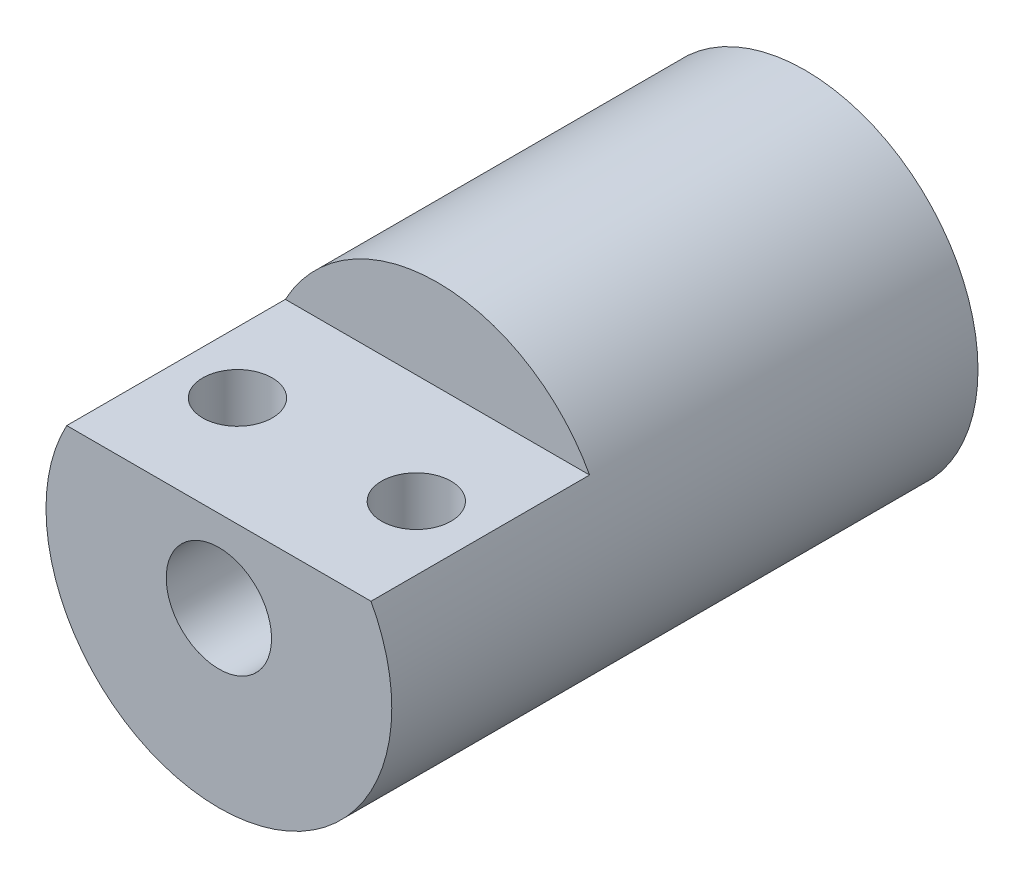
from build123d import *

# Parameters (mm, degrees)
SKETCH1_R           = 8.7
BOSS_EXTRUDE1_DEPTH = 29.5
SKETCH5_R           = 1.75
CUT_EXTRUDE1_DEPTH  = 32.962947298
SKETCH4_R           = 1.25
CUT_EXTRUDE2_DEPTH  = 7
SKETCH6_R           = 2.65
CUT_EXTRUDE3_DEPTH  = 20.9
SKETCH2_W           = 17
SKETCH2_H           = 4.566888769
CUT_EXTRUDE4_DEPTH  = 11
FILLET1_R           = 0.3
SKETCH7_R           = 1.75
CUT_EXTRUDE5_DEPTH  = 34.326097039


with BuildPart() as part:
    # Sketch1 → Boss-Extrude1 (new body)
    with BuildSketch(Plane.XY):
        Circle(SKETCH1_R)
    extrude(amount=BOSS_EXTRUDE1_DEPTH)

    # Sketch5 → Cut-Extrude1 (cut, through all)
    with BuildSketch(Plane(origin=(0, 0, 0), x_dir=(-1, 0, 0), z_dir=(0, 0, -1))):
        Circle(SKETCH5_R)
    extrude(amount=-CUT_EXTRUDE1_DEPTH, mode=Mode.SUBTRACT)

    # Sketch4 → Cut-Extrude2 (cut)
    with BuildSketch(Plane(origin=(0, 0, 0), x_dir=(-1, 0, 0), z_dir=(0, 0, -1))):
        with Locations((0, 6)):
            Circle(SKETCH4_R)
        with Locations((6, 0)):
            Circle(SKETCH4_R)
        with Locations((0, -6)):
            Circle(SKETCH4_R)
        with Locations((-6, 0)):
            Circle(SKETCH4_R)
    extrude(amount=-CUT_EXTRUDE2_DEPTH, mode=Mode.SUBTRACT)

    # Sketch6 → Cut-Extrude3 (cut)
    with BuildSketch(Plane.XY.offset(29.5)):
        Circle(SKETCH6_R)
    extrude(amount=-CUT_EXTRUDE3_DEPTH, mode=Mode.SUBTRACT)

    # Sketch2 → Cut-Extrude4 (cut)
    with BuildSketch(Plane.XY.offset(29.5)):
        with Locations((0.844453543, 6.416555616)):
            Rectangle(SKETCH2_W, SKETCH2_H)
    extrude(amount=-CUT_EXTRUDE4_DEPTH, mode=Mode.SUBTRACT)

    # Fillet1
    fillet1_edges = [part.edges().sort_by_distance(p)[0] for p in [
        (1.75, 0, 8.6),
    ]]
    fillet(fillet1_edges, radius=FILLET1_R)

    # Sketch7 → Cut-Extrude5 (cut, through all)
    with BuildSketch(Plane(origin=(0, 4.133111231, 0), x_dir=(1, 0, 0), z_dir=(0, 1, 0))):
        with Locations((-4.564549334, -24)):
            Circle(SKETCH7_R)
        with Locations((4.435450666, -24)):
            Circle(SKETCH7_R)
    extrude(amount=-CUT_EXTRUDE5_DEPTH, mode=Mode.SUBTRACT)


solid = part.part
